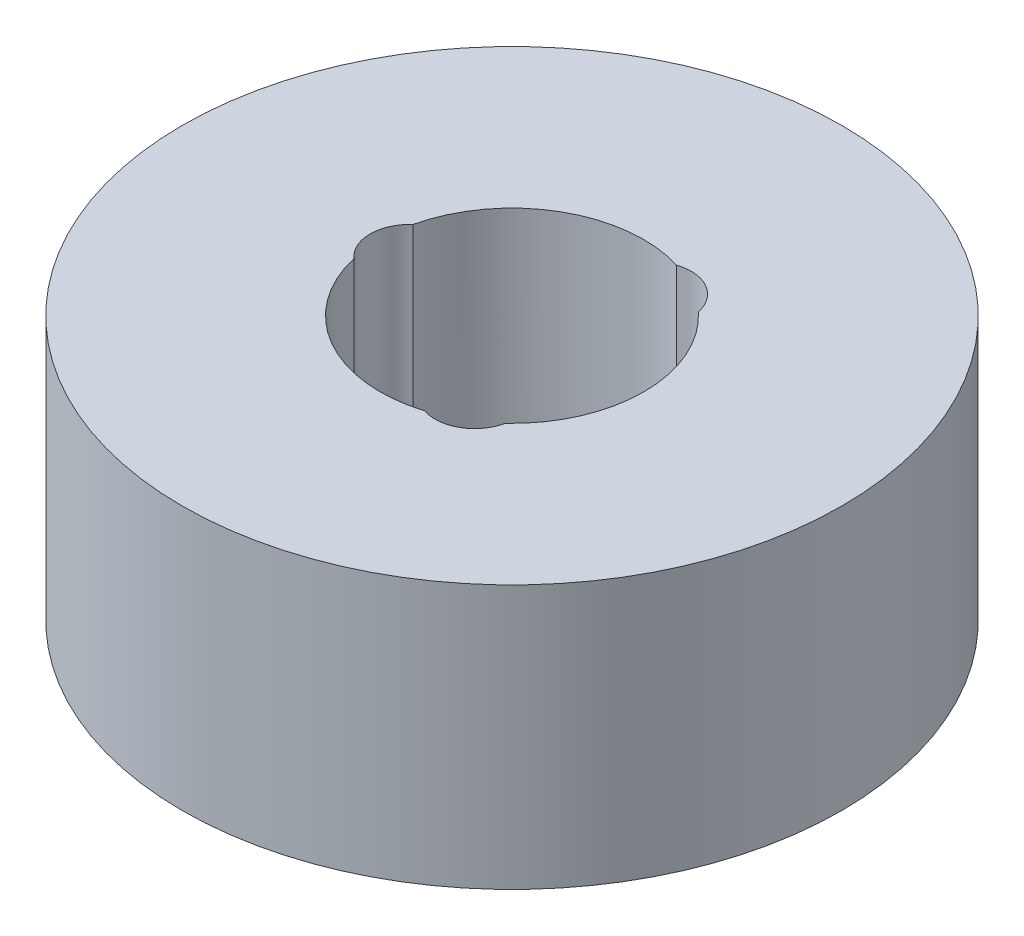
from build123d import *

# Parameters (mm, degrees)
SKETCH1_R           = 12.5
BOSS_EXTRUDE1_DEPTH = 10
SKETCH2_R           = 5
CUT_EXTRUDE1_DEPTH  = 21.310096012
SKETCH3_R           = 1.5
CUT_EXTRUDE2_DEPTH  = 8.441505724
CIRPATTERN1_COUNT   = 3


with BuildPart() as part:
    # Sketch1 → Boss-Extrude1 (new body)
    with BuildSketch(Plane(origin=(0, 0, 0), x_dir=(1, 0, 0), z_dir=(0, 1, 0))):
        Circle(SKETCH1_R)
    extrude(amount=BOSS_EXTRUDE1_DEPTH)

    # Sketch2 → Cut-Extrude1 (cut, through all)
    with BuildSketch(Plane(origin=(0, 0, 0), x_dir=(1, 0, 0), z_dir=(0, 1, 0))):
        Circle(SKETCH2_R)
    extrude(amount=CUT_EXTRUDE1_DEPTH, mode=Mode.SUBTRACT)

    # Sketch3 → Cut-Extrude2 (cut)
    with BuildSketch(Plane(origin=(0, 10, 0), x_dir=(1, 0, 0), z_dir=(0, 1, 0))):
        with Locations((-3.875873722, 0)):
            Circle(SKETCH3_R)
    cut_extrude2 = extrude(amount=-CUT_EXTRUDE2_DEPTH, mode=Mode.SUBTRACT)

    # CirPattern1: Cut-Extrude2 ×3 about axis
    cirpattern1_axis = Axis((0, 0, 0), (0, 1, 0))
    for i in range(1, CIRPATTERN1_COUNT):
        add(cut_extrude2.rotate(cirpattern1_axis, i * 360 / CIRPATTERN1_COUNT), mode=Mode.SUBTRACT)


solid = part.part
